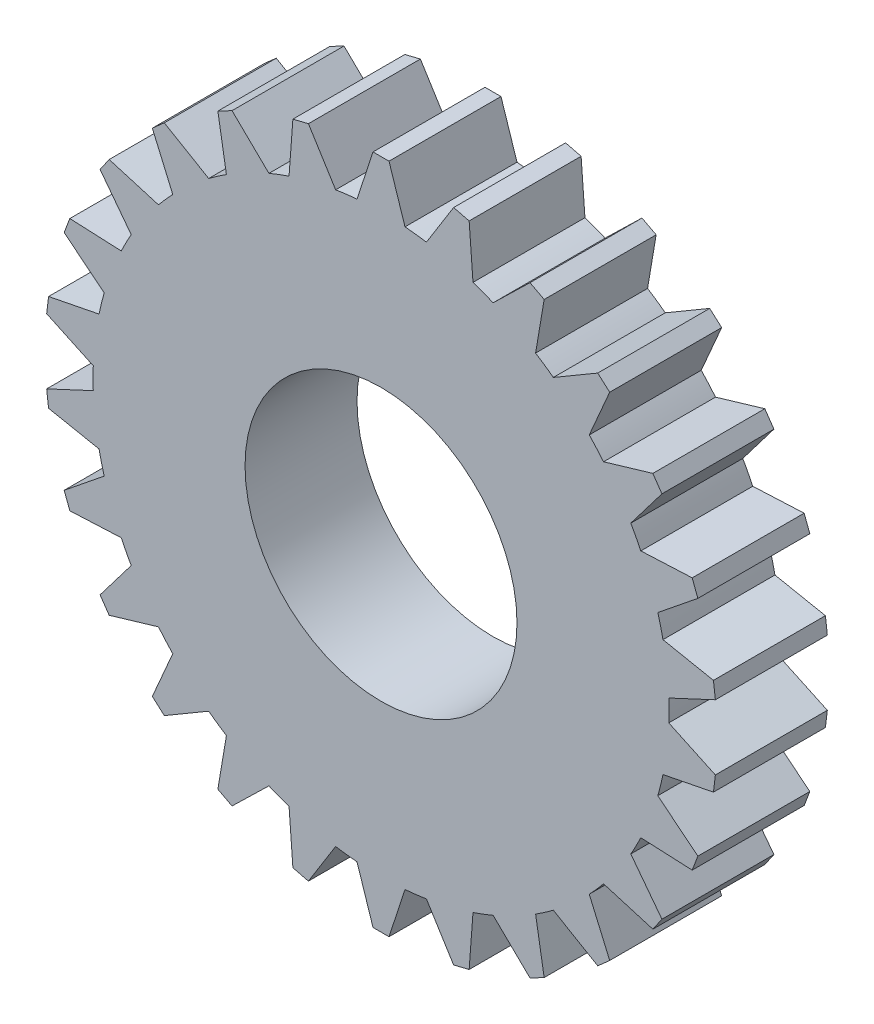
from build123d import *

# Parameters (mm, degrees)
SKETCH1_R           = 8.5
BOSS_EXTRUDE1_DEPTH = 7


with BuildPart() as part:
    # Sketch1 → Boss-Extrude1 (new body)
    with BuildSketch(Plane.XY):
        with BuildLine():
            Line((5.509675159, 20.264340099), (4.538733341, 20.503655763))
            Line((4.538733341, 20.503655763), (2.836285944, 17.775136625))
            ThreePointArc((2.836285944, 17.775136625), (2.169660245, 17.868759734), (1.5, 17.937391115))
            Line((1.5, 17.937391115), (0.5, 20.994046775))
            Line((0.5, 20.994046775), (-0.5, 20.994046775))
            Line((-0.5, 20.994046775), (-1.5, 17.937391115))
            ThreePointArc((-1.5, 17.937391115), (-2.169660245, 17.868759734), (-2.836285944, 17.775136625))
            Line((-2.836285944, 17.775136625), (-4.538733341, 20.503655763))
            Line((-4.538733341, 20.503655763), (-5.509675159, 20.264340099))
            Line((-5.509675159, 20.264340099), (-5.749111396, 17.057189632))
            ThreePointArc((-5.749111396, 17.057189632), (-6.382887967, 16.830292368), (-7.007737259, 16.579855805))
            Line((-7.007737259, 16.579855805), (-9.313691999, 18.821666806))
            Line((-9.313691999, 18.821666806), (-10.199148024, 18.356943634))
            Line((-10.199148024, 18.356943634), (-9.664105335, 15.185686289))
            ThreePointArc((-9.664105335, 15.185686289), (-10.225165441, 14.813709586), (-10.771924356, 14.421014031))
            Line((-10.771924356, 14.421014031), (-13.547372731, 16.045830988))
            Line((-13.547372731, 16.045830988), (-14.295883479, 15.38270833))
            Line((-14.295883479, 15.38270833), (-13.0174566, 12.431646056))
            ThreePointArc((-13.0174566, 12.431646056), (-13.473193467, 11.936207848), (-13.910086363, 11.424075339))
            Line((-13.910086363, 11.424075339), (-16.993729402, 12.337469797))
            Line((-16.993729402, 12.337469797), (-17.561794149, 11.514485931))
            Line((-17.561794149, 11.514485931), (-15.614280604, 8.955123742))
            ThreePointArc((-15.614280604, 8.955123742), (-15.938208462, 8.365017097), (-16.239844713, 7.763210914))
            Line((-16.239844713, 7.763210914), (-19.452472291, 7.912099707))
            Line((-19.452472291, 7.912099707), (-19.807077178, 6.977083464))
            Line((-19.807077178, 6.977083464), (-17.303659374, 4.958162186))
            ThreePointArc((-17.303659374, 4.958162186), (-17.476952714, 4.307681957), (-17.625802317, 3.651176889))
            Line((-17.625802317, 3.651176889), (-20.780708197, 3.02690714))
            Line((-20.780708197, 3.02690714), (-20.901244877, 2.034198266))
            Line((-20.901244877, 2.034198266), (-17.987412358, 0.673050266))
            ThreePointArc((-17.987412358, 0.673050266), (-18, 0), (-17.987412358, -0.673050266))
            Line((-17.987412358, -0.673050266), (-20.901244877, -2.034198266))
            Line((-20.901244877, -2.034198266), (-20.780708197, -3.02690714))
            Line((-20.780708197, -3.02690714), (-17.625802317, -3.651176889))
            ThreePointArc((-17.625802317, -3.651176889), (-17.476952714, -4.307681957), (-17.303659374, -4.958162186))
            Line((-17.303659374, -4.958162186), (-19.807077178, -6.977083464))
            Line((-19.807077178, -6.977083464), (-19.452472291, -7.912099707))
            Line((-19.452472291, -7.912099707), (-16.239844713, -7.763210914))
            ThreePointArc((-16.239844713, -7.763210914), (-15.938208462, -8.365017097), (-15.614280604, -8.955123742))
            Line((-15.614280604, -8.955123742), (-17.561794149, -11.514485931))
            Line((-17.561794149, -11.514485931), (-16.993729402, -12.337469797))
            Line((-16.993729402, -12.337469797), (-13.910086363, -11.424075339))
            ThreePointArc((-13.910086363, -11.424075339), (-13.473193467, -11.936207848), (-13.0174566, -12.431646056))
            Line((-13.0174566, -12.431646056), (-14.295883479, -15.38270833))
            Line((-14.295883479, -15.38270833), (-13.547372731, -16.045830988))
            Line((-13.547372731, -16.045830988), (-10.771924356, -14.421014031))
            ThreePointArc((-10.771924356, -14.421014031), (-10.225165441, -14.813709586), (-9.664105335, -15.185686289))
            Line((-9.664105335, -15.185686289), (-10.199148024, -18.356943634))
            Line((-10.199148024, -18.356943634), (-9.313691999, -18.821666806))
            Line((-9.313691999, -18.821666806), (-7.007737259, -16.579855805))
            ThreePointArc((-7.007737259, -16.579855805), (-6.382887967, -16.830292368), (-5.749111396, -17.057189632))
            Line((-5.749111396, -17.057189632), (-5.509675159, -20.264340099))
            Line((-5.509675159, -20.264340099), (-4.538733341, -20.503655763))
            Line((-4.538733341, -20.503655763), (-2.836285944, -17.775136625))
            ThreePointArc((-2.836285944, -17.775136625), (-2.169660245, -17.868759734), (-1.5, -17.937391115))
            Line((-1.5, -17.937391115), (-0.5, -20.994046775))
            Line((-0.5, -20.994046775), (0.5, -20.994046775))
            Line((0.5, -20.994046775), (1.5, -17.937391115))
            ThreePointArc((1.5, -17.937391115), (2.169660245, -17.868759734), (2.836285944, -17.775136625))
            Line((2.836285944, -17.775136625), (4.538733341, -20.503655763))
            Line((4.538733341, -20.503655763), (5.509675159, -20.264340099))
            Line((5.509675159, -20.264340099), (5.749111396, -17.057189632))
            ThreePointArc((5.749111396, -17.057189632), (6.382887967, -16.830292368), (7.007737259, -16.579855805))
            Line((7.007737259, -16.579855805), (9.313691999, -18.821666806))
            Line((9.313691999, -18.821666806), (10.199148024, -18.356943634))
            Line((10.199148024, -18.356943634), (9.664105335, -15.185686289))
            ThreePointArc((9.664105335, -15.185686289), (10.225165441, -14.813709586), (10.771924356, -14.421014031))
            Line((10.771924356, -14.421014031), (13.547372731, -16.045830988))
            Line((13.547372731, -16.045830988), (14.295883479, -15.38270833))
            Line((14.295883479, -15.38270833), (13.0174566, -12.431646056))
            ThreePointArc((13.0174566, -12.431646056), (13.473193467, -11.936207848), (13.910086363, -11.424075339))
            Line((13.910086363, -11.424075339), (16.993729402, -12.337469797))
            Line((16.993729402, -12.337469797), (17.561794149, -11.514485931))
            Line((17.561794149, -11.514485931), (15.614280604, -8.955123742))
            ThreePointArc((15.614280604, -8.955123742), (15.938208462, -8.365017097), (16.239844713, -7.763210914))
            Line((16.239844713, -7.763210914), (19.452472291, -7.912099707))
            Line((19.452472291, -7.912099707), (19.807077178, -6.977083464))
            Line((19.807077178, -6.977083464), (17.303659374, -4.958162186))
            ThreePointArc((17.303659374, -4.958162186), (17.476952714, -4.307681957), (17.625802317, -3.651176889))
            Line((17.625802317, -3.651176889), (20.780708197, -3.02690714))
            Line((20.780708197, -3.02690714), (20.901244877, -2.034198266))
            Line((20.901244877, -2.034198266), (17.987412358, -0.673050266))
            ThreePointArc((17.987412358, -0.673050266), (18, 0), (17.987412358, 0.673050266))
            Line((17.987412358, 0.673050266), (20.901244877, 2.034198266))
            Line((20.901244877, 2.034198266), (20.780708197, 3.02690714))
            Line((20.780708197, 3.02690714), (17.625802317, 3.651176889))
            ThreePointArc((17.625802317, 3.651176889), (17.476952714, 4.307681957), (17.303659374, 4.958162186))
            Line((17.303659374, 4.958162186), (19.807077178, 6.977083464))
            Line((19.807077178, 6.977083464), (19.452472291, 7.912099707))
            Line((19.452472291, 7.912099707), (16.239844713, 7.763210914))
            ThreePointArc((16.239844713, 7.763210914), (15.938208462, 8.365017097), (15.614280604, 8.955123742))
            Line((15.614280604, 8.955123742), (17.561794149, 11.514485931))
            Line((17.561794149, 11.514485931), (16.993729402, 12.337469797))
            Line((16.993729402, 12.337469797), (13.910086363, 11.424075339))
            ThreePointArc((13.910086363, 11.424075339), (13.473193467, 11.936207848), (13.0174566, 12.431646056))
            Line((13.0174566, 12.431646056), (14.295883479, 15.38270833))
            Line((14.295883479, 15.38270833), (13.547372731, 16.045830988))
            Line((13.547372731, 16.045830988), (10.771924356, 14.421014031))
            ThreePointArc((10.771924356, 14.421014031), (10.225165441, 14.813709586), (9.664105335, 15.185686289))
            Line((9.664105335, 15.185686289), (10.199148024, 18.356943634))
            Line((10.199148024, 18.356943634), (9.313691999, 18.821666806))
            Line((9.313691999, 18.821666806), (7.007737259, 16.579855805))
            ThreePointArc((7.007737259, 16.579855805), (6.382887967, 16.830292368), (5.749111396, 17.057189632))
            Line((5.749111396, 17.057189632), (5.509675159, 20.264340099))
        make_face()
        Circle(SKETCH1_R, mode=Mode.SUBTRACT)
    extrude(amount=BOSS_EXTRUDE1_DEPTH)


solid = part.part
